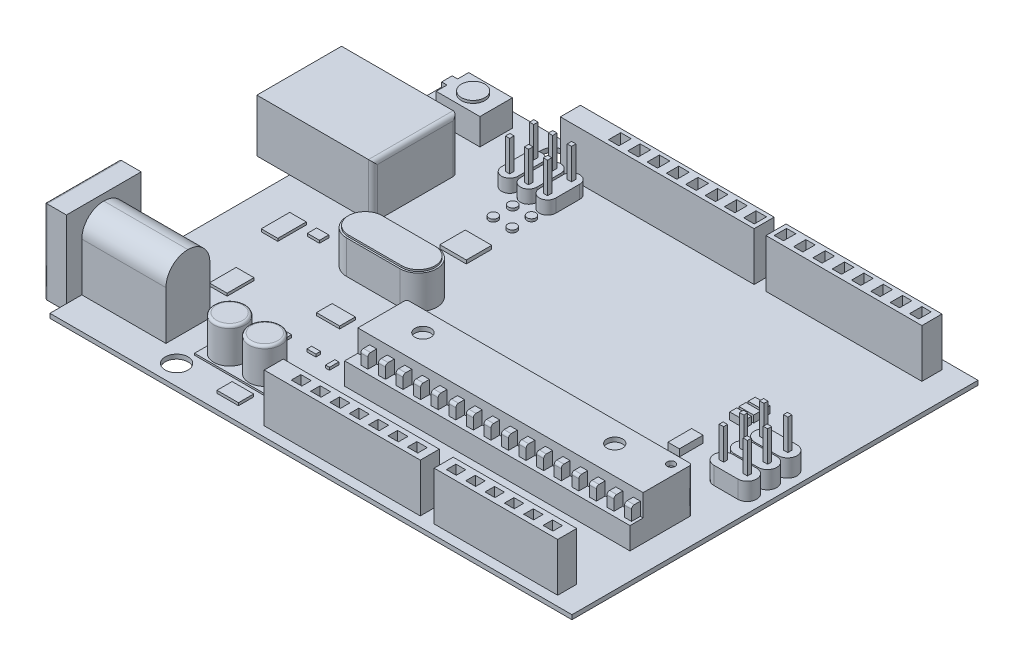
from build123d import *

# Parameters (mm, degrees)
BOSS_EXTRUDE2_DEPTH    = 55
SKETCH3_W              = 140.514955922
SKETCH3_H              = 21.639303212
BOSS_EXTRUDE3_DEPTH    = 55
CUT_EXTRUDE1_START     = 5
SKETCH4_W              = 11.850658933
SKETCH4_H              = 10.834888168
SKETCH4_W_2            = 11.204003532
CUT_EXTRUDE1_DEPTH     = 50
SKETCH5_W              = 220.455310393
SKETCH5_H              = 22.830323406
BOSS_EXTRUDE4_DEPTH    = 55
SKETCH6_W              = 177.429354246
SKETCH6_H              = 22.830323406
BOSS_EXTRUDE5_DEPTH    = 55
CUT_EXTRUDE2_START     = 5
SKETCH7_W              = 11.936344285
SKETCH7_H              = 14.002250028
SKETCH7_W_2            = 10.5429453
CUT_EXTRUDE2_DEPTH     = 50
SKETCH8_W              = 324.618660934
SKETCH8_H              = 70.631313038
BOSS_EXTRUDE6_DEPTH    = 25
SKETCH9_W              = 324.618660934
SKETCH9_H              = 55.631313038
BOSS_EXTRUDE7_DEPTH    = 25
FILLET1_R              = 3
FILLET2_R              = 3
SKETCH10_W             = 8
SKETCH10_H             = 15
BOSS_EXTRUDE8_DEPTH    = 10
FILLET3_R              = 3
LPATTERN1_COUNT        = 16
LPATTERN1_PITCH        = 20
FILLET3_OF_LPATTERN1_R = 3
SKETCH11_R             = 9
SKETCH11_R_2           = 4.513225895
CUT_EXTRUDE3_DEPTH     = 5
BOSS_EXTRUDE9_DEPTH    = 20
BOSS_EXTRUDE9_2_DEPTH  = 20
BOSS_EXTRUDE9_3_DEPTH  = 20
SKETCH13_W             = 5
SKETCH13_H             = 4.487343
BOSS_EXTRUDE10_DEPTH   = 35
SKETCH14_W             = 13.054082129
SKETCH14_H             = 26.924044392
BOSS_EXTRUDE11_DEPTH   = 8
SKETCH15_W             = 16.725542728
SKETCH15_H             = 8
BOSS_EXTRUDE12_DEPTH   = 8
BOSS_EXTRUDE12_2_DEPTH = 8
BOSS_EXTRUDE12_3_DEPTH = 8
BOSS_EXTRUDE13_DEPTH   = 15
BOSS_EXTRUDE13_2_DEPTH = 15
BOSS_EXTRUDE13_3_DEPTH = 15
SKETCH17_W             = 4.794005122
SKETCH17_H             = 5
BOSS_EXTRUDE14_DEPTH   = 35
SKETCH18_R             = 5
BOSS_EXTRUDE15_DEPTH   = 3
BOSS_EXTRUDE15_2_DEPTH = 3
SKETCH19_R             = 5
BOSS_EXTRUDE16_DEPTH   = 3
BOSS_EXTRUDE16_2_DEPTH = 3
SKETCH20_W             = 30.070200568
SKETCH20_H             = 28.94608092
BOSS_EXTRUDE17_DEPTH   = 4
BOSS_EXTRUDE18_DEPTH   = 38
BOSS_EXTRUDE19_DEPTH   = 2
SKETCH23_W             = 26.397561438
SKETCH23_H             = 17.836190161
BOSS_EXTRUDE20_DEPTH   = 3
SKETCH24_W             = 8.430897355
SKETCH24_H             = 10.67913665
BOSS_EXTRUDE21_DEPTH   = 3
SKETCH24_W_2           = 10.117076826
SKETCH24_H_2           = 5.339568325
BOSS_EXTRUDE21_2_DEPTH = 3
SKETCH24_W_3           = 4.49647859
BOSS_EXTRUDE21_3_DEPTH = 3
SKETCH25_W             = 80
SKETCH25_H             = 39.903369736
BOSS_EXTRUDE22_DEPTH   = 2
SKETCH26_R             = 18
BOSS_EXTRUDE23_DEPTH   = 40
FILLET4_R              = 3
SKETCH27_W             = 24.491756817
SKETCH27_H             = 17.260857185
BOSS_EXTRUDE24_DEPTH   = 3
SKETCH28_W             = 131.987807193
SKETCH28_H             = 96.315426871
BOSS_EXTRUDE25_DEPTH   = 60
CUT_EXTRUDE4_DEPTH     = 80
SKETCH30_W             = 40.013805294
SKETCH30_H             = 14.419389296
BOSS_EXTRUDE26_DEPTH   = 80
FILLET5_R              = 5
BOSS_EXTRUDE27_DEPTH   = 30
SKETCH32_R             = 13.354909124
BOSS_EXTRUDE28_DEPTH   = 3
SKETCH33_W             = 95.708096648
SKETCH33_H             = 50
BOSS_EXTRUDE29_DEPTH   = 80
SKETCH34_W             = 85
SKETCH34_H             = 95
BOSS_EXTRUDE30_DEPTH   = 25
FILLET6_R              = 25
SKETCH35_R             = 21.697959762
CUT_EXTRUDE5_DEPTH     = 97
FILLET7_R              = 3
SKETCH36_W             = 18.831629025
SKETCH36_H             = 32.390401922
BOSS_EXTRUDE31_DEPTH   = 3
SKETCH36_W_2           = 13.782631251
SKETCH36_H_2           = 10.600232663
BOSS_EXTRUDE31_2_DEPTH = 3
SKETCH37_W             = 20.243239651
SKETCH37_H             = 30.580213089
BOSS_EXTRUDE32_DEPTH   = 3
SKETCH39_W             = 594
SKETCH39_H             = 462
BOSS_EXTRUDE33_DEPTH   = 5
SKETCH38_R             = 13.537031913
SKETCH38_R_2           = 12.986709959
CUT_EXTRUDE6_DEPTH     = 758.585803721
SCALE1_SCALE           = 0.5


with BuildPart() as part:
    # Sketch2 → Boss-Extrude2 (new body)
    with BuildSketch(Plane(origin=(0, 100, 0), x_dir=(1, 0, 0), z_dir=(0, 1, 0))):
        Polygon((406.248513128, 32.646926651), (410.39103989, 32.646926651), (410.39103989, 11.007623439), (406.248513128, 11.007623439), (232.853057519, 11.007623439), (232.853057519, 32.646926651), align=None)
    extrude(amount=BOSS_EXTRUDE2_DEPTH)


with BuildPart() as body_2:
    # Sketch3 → Boss-Extrude3 (new body)
    with BuildSketch(Plane(origin=(0, 100, 0), x_dir=(1, 0, 0), z_dir=(0, 1, 0))):
        with Locations((496.46809161, 21.827275045)):
            Rectangle(SKETCH3_W, SKETCH3_H)
    extrude(amount=BOSS_EXTRUDE3_DEPTH)


with BuildPart() as cut_extrude1_tool:
    # Sketch4 → Cut-Extrude1 (new body)
    with BuildSketch(Plane(origin=(0, 100, 0), x_dir=(1, 0, 0), z_dir=(0, 1, 0)).offset(CUT_EXTRUDE1_START)):
        with Locations((264.057662434, 21.953706004)):
            Rectangle(SKETCH4_W, SKETCH4_H)
        with Locations((286.057662434, 21.953706004)):
            Rectangle(SKETCH4_W, SKETCH4_H)
        with Locations((308.057662434, 21.953706004)):
            Rectangle(SKETCH4_W, SKETCH4_H)
        with Locations((330.057662434, 21.953706004)):
            Rectangle(SKETCH4_W, SKETCH4_H)
        with Locations((352.057662434, 21.953706004)):
            Rectangle(SKETCH4_W, SKETCH4_H)
        with Locations((374.057662434, 21.953706004)):
            Rectangle(SKETCH4_W, SKETCH4_H)
        with Locations((396.057662434, 21.953706004)):
            Rectangle(SKETCH4_W, SKETCH4_H)
        with Locations((440.192463475, 21.953706004)):
            Rectangle(SKETCH4_W_2, SKETCH4_H)
        with Locations((462.192463475, 21.953706004)):
            Rectangle(SKETCH4_W_2, SKETCH4_H)
        with Locations((484.192463475, 21.953706004)):
            Rectangle(SKETCH4_W_2, SKETCH4_H)
        with Locations((506.192463475, 21.953706004)):
            Rectangle(SKETCH4_W_2, SKETCH4_H)
        with Locations((528.192463475, 21.953706004)):
            Rectangle(SKETCH4_W_2, SKETCH4_H)
        with Locations((550.192463475, 21.953706004)):
            Rectangle(SKETCH4_W_2, SKETCH4_H)
    extrude(amount=CUT_EXTRUDE1_DEPTH)


with BuildPart() as part_1:
    add(part.part)

    # Cut-Extrude1: cut by cut_extrude1_tool
    add(cut_extrude1_tool.part, mode=Mode.SUBTRACT)



with BuildPart() as body_2_1:
    add(body_2.part)

    # Cut-Extrude1: cut by cut_extrude1_tool
    add(cut_extrude1_tool.part, mode=Mode.SUBTRACT)


with BuildPart() as body_3:
    # Sketch5 → Boss-Extrude4 (new body)
    with BuildSketch(Plane(origin=(0, 100, 0), x_dir=(1, 0, 0), z_dir=(0, 1, 0))):
        with Locations((262.041067284, 440.396872493)):
            Rectangle(SKETCH5_W, SKETCH5_H)
    extrude(amount=BOSS_EXTRUDE4_DEPTH)


with BuildPart() as body_4:
    # Sketch6 → Boss-Extrude5 (new body)
    with BuildSketch(Plane(origin=(0, 100, 0), x_dir=(1, 0, 0), z_dir=(0, 1, 0))):
        with Locations((474.456716745, 440.396872493)):
            Rectangle(SKETCH6_W, SKETCH6_H)
    extrude(amount=BOSS_EXTRUDE5_DEPTH)


with BuildPart() as cut_extrude2_tool:
    # Sketch7 → Cut-Extrude2 (new body)
    with BuildSketch(Plane(origin=(0, 100, 0), x_dir=(1, 0, 0), z_dir=(0, 1, 0)).offset(CUT_EXTRUDE2_START)):
        with Locations((207.691240249, 440.745978972)):
            Rectangle(SKETCH7_W, SKETCH7_H)
        with Locations((229.691240249, 440.745978972)):
            Rectangle(SKETCH7_W, SKETCH7_H)
        with Locations((251.691240249, 440.745978972)):
            Rectangle(SKETCH7_W, SKETCH7_H)
        with Locations((273.691240248, 440.745978972)):
            Rectangle(SKETCH7_W, SKETCH7_H)
        with Locations((295.691240249, 440.745978972)):
            Rectangle(SKETCH7_W, SKETCH7_H)
        with Locations((317.691240249, 440.745978972)):
            Rectangle(SKETCH7_W, SKETCH7_H)
        with Locations((339.691240249, 440.745978972)):
            Rectangle(SKETCH7_W, SKETCH7_H)
        with Locations((361.691240249, 440.745978972)):
            Rectangle(SKETCH7_W, SKETCH7_H)
        with Locations((395.678951184, 440.745978972)):
            Rectangle(SKETCH7_W_2, SKETCH7_H)
        with Locations((417.678951184, 440.745978972)):
            Rectangle(SKETCH7_W_2, SKETCH7_H)
        with Locations((439.678951184, 440.745978972)):
            Rectangle(SKETCH7_W_2, SKETCH7_H)
        with Locations((461.678951184, 440.745978972)):
            Rectangle(SKETCH7_W_2, SKETCH7_H)
        with Locations((483.678951184, 440.745978972)):
            Rectangle(SKETCH7_W_2, SKETCH7_H)
        with Locations((505.678951184, 440.745978972)):
            Rectangle(SKETCH7_W_2, SKETCH7_H)
        with Locations((527.678951184, 440.745978972)):
            Rectangle(SKETCH7_W_2, SKETCH7_H)
        with Locations((549.678951184, 440.745978972)):
            Rectangle(SKETCH7_W_2, SKETCH7_H)
    extrude(amount=CUT_EXTRUDE2_DEPTH)


with BuildPart() as body_3_1:
    add(body_3.part)

    # Cut-Extrude2: cut by cut_extrude2_tool
    add(cut_extrude2_tool.part, mode=Mode.SUBTRACT)


with BuildPart() as body_4_1:
    add(body_4.part)

    # Cut-Extrude2: cut by cut_extrude2_tool
    add(cut_extrude2_tool.part, mode=Mode.SUBTRACT)


with BuildPart() as body_5:
    # Sketch8 → Boss-Extrude6 (new body)
    with BuildSketch(Plane(origin=(0, 100, 0), x_dir=(1, 0, 0), z_dir=(0, 1, 0))):
        with Locations((401.876798148, 131.117335097)):
            Rectangle(SKETCH8_W, SKETCH8_H)
    extrude(amount=BOSS_EXTRUDE6_DEPTH)

    # Sketch9 → Boss-Extrude7 (add)
    with BuildSketch(Plane(origin=(0, 125, 0), x_dir=(1, 0, 0), z_dir=(0, 1, 0))):
        with Locations((401.876798148, 138.617335097)):
            Rectangle(SKETCH9_W, SKETCH9_H)
    extrude(amount=BOSS_EXTRUDE7_DEPTH)

    # Fillet1
    fillet1_edges = [body_5.edges().sort_by_distance(p)[0] for p in [
        (239.567467681, 125, -166.432991616),
    ]]
    fillet(fillet1_edges, radius=FILLET1_R)

    # Fillet2
    fillet2_edges = [body_5.edges().sort_by_distance(p)[0] for p in [
        (564.186128615, 125, -166.432991616),
    ]]
    fillet(fillet2_edges, radius=FILLET2_R)

    # Sketch10 → Boss-Extrude8 (add)
    with BuildSketch(Plane.XY.offset(-110.801678578)):
        with Locations((257.009389887, 132.5)):
            Rectangle(SKETCH10_W, SKETCH10_H)
    boss_extrude8 = extrude(amount=BOSS_EXTRUDE8_DEPTH)

    # Fillet3
    fillet3_edges = [body_5.edges().sort_by_distance(p)[0] for p in [
        (257.009389887, 140, -100.801678578),
    ]]
    fillet(fillet3_edges, radius=FILLET3_R)

    # LPattern1: Boss-Extrude8 ×16
    with Locations(*[(i * LPATTERN1_PITCH, 0, 0) for i in range(1, LPATTERN1_COUNT)]):
        add(boss_extrude8)

    # Fillet3 of LPattern1
    fillet3_of_lpattern1_edges = [body_5.edges().sort_by_distance(p)[0] for p in [
        (277.009389887, 140, -100.801678578),
        (297.009389887, 140, -100.801678578),
        (317.009389887, 140, -100.801678578),
        (337.009389887, 140, -100.801678578),
        (357.009389887, 140, -100.801678578),
        (377.009389887, 140, -100.801678578),
        (397.009389887, 140, -100.801678578),
        (417.009389887, 140, -100.801678578),
        (437.009389887, 140, -100.801678578),
        (457.009389887, 140, -100.801678578),
        (477.009389887, 140, -100.801678578),
        (497.009389887, 140, -100.801678578),
        (517.009389887, 140, -100.801678578),
        (537.009389887, 140, -100.801678578),
        (557.009389887, 140, -100.801678578),
    ]]
    fillet(fillet3_of_lpattern1_edges, radius=FILLET3_OF_LPATTERN1_R)

    # Sketch11 → Cut-Extrude3 (cut)
    with BuildSketch(Plane(origin=(0, 150, 0), x_dir=(1, 0, 0), z_dir=(0, 1, 0))):
        with Locations(Location((281.372940119, 143.017085272, 0), (0, 0, 270))):
            Circle(SKETCH11_R)
        with Locations(Location((499.66166973, 143.017085272, 0), (0, 0, 270))):
            Circle(SKETCH11_R)
        with Locations(Location((552.041174275, 154.806553195, 0), (0, 0, 270))):
            Circle(SKETCH11_R_2)
    extrude(amount=-CUT_EXTRUDE3_DEPTH, mode=Mode.SUBTRACT)


with BuildPart() as body_6:
    # Sketch12 → Boss-Extrude9 (new body)
    with BuildSketch(Plane(origin=(0, 100, 0), x_dir=(1, 0, 0), z_dir=(0, 1, 0))):
        with BuildLine():
            Line((547.517549409, 275.451253059), (574.628558454, 275.451253059))
            ThreePointArc((574.628558454, 275.451253059), (585.330272551, 264.749538962), (574.628558454, 254.047824865))
            Line((574.628558454, 254.047824865), (547.517549409, 254.047824865))
            ThreePointArc((547.517549409, 254.047824865), (536.815835312, 264.749538962), (547.517549409, 275.451253059))
        make_face()
    extrude(amount=BOSS_EXTRUDE9_DEPTH)



with BuildPart() as body_7:
    # Sketch12 → Boss-Extrude9 2 (new body)
    with BuildSketch(Plane(origin=(0, 100, 0), x_dir=(1, 0, 0), z_dir=(0, 1, 0))):
        with BuildLine():
            Line((547.517549409, 252.451253059), (574.628558454, 252.451253059))
            ThreePointArc((574.628558454, 252.451253059), (585.330272551, 241.749538962), (574.628558454, 231.047824865))
            Line((574.628558454, 231.047824865), (547.517549409, 231.047824865))
            ThreePointArc((547.517549409, 231.047824865), (536.815835312, 241.749538962), (547.517549409, 252.451253059))
        make_face()
    extrude(amount=BOSS_EXTRUDE9_2_DEPTH)


with BuildPart() as body_8:
    # Sketch12 → Boss-Extrude9 3 (new body)
    with BuildSketch(Plane(origin=(0, 100, 0), x_dir=(1, 0, 0), z_dir=(0, 1, 0))):
        with BuildLine():
            Line((547.517549409, 229.451253059), (574.628558454, 229.451253059))
            ThreePointArc((574.628558454, 229.451253059), (585.330272551, 218.749538962), (574.628558454, 208.047824865))
            Line((574.628558454, 208.047824865), (547.517549409, 208.047824865))
            ThreePointArc((547.517549409, 208.047824865), (536.815835312, 218.749538962), (547.517549409, 229.451253059))
        make_face()
    extrude(amount=BOSS_EXTRUDE9_3_DEPTH)


with BuildPart() as body_6_1:
    add(body_6.part)

    add(body_7.part)  # Boss-Extrude10 merges body 7

    add(body_8.part)  # Boss-Extrude10 merges body 8
    # Sketch13 → Boss-Extrude10 (add)
    with BuildSketch(Plane(origin=(0, 120, 0), x_dir=(1, 0, 0), z_dir=(0, 1, 0))):
        with Locations((547.517549409, 241.749538962)):
            Rectangle(SKETCH13_W, SKETCH13_H)
        with Locations((547.517549409, 264.749538962)):
            Rectangle(SKETCH13_W, SKETCH13_H)
        with Locations((574.628558454, 264.749538962)):
            Rectangle(SKETCH13_W, SKETCH13_H)
        with Locations((574.628558454, 241.749538962)):
            Rectangle(SKETCH13_W, SKETCH13_H)
        with Locations((547.517549409, 218.749538962)):
            Rectangle(SKETCH13_W, SKETCH13_H)
        with Locations((574.628558454, 218.749538962)):
            Rectangle(SKETCH13_W, SKETCH13_H)
    extrude(amount=BOSS_EXTRUDE10_DEPTH)


with BuildPart() as body_7_2:
    # Sketch14 → Boss-Extrude11 (new body)
    with BuildSketch(Plane(origin=(0, 100, 0), x_dir=(1, 0, 0), z_dir=(0, 1, 0))):
        with Locations((493.129270674, 230.042416205)):
            Rectangle(SKETCH14_W, SKETCH14_H)
    extrude(amount=BOSS_EXTRUDE11_DEPTH)


with BuildPart() as body_8_2:
    # Sketch15 → Boss-Extrude12 (new body)
    with BuildSketch(Plane(origin=(0, 100, 0), x_dir=(1, 0, 0), z_dir=(0, 1, 0))):
        with Locations((500.268221838, 306.602608522)):
            Rectangle(SKETCH15_W, SKETCH15_H)
    extrude(amount=BOSS_EXTRUDE12_DEPTH)


with BuildPart() as body_9:
    # Sketch15 → Boss-Extrude12 2 (new body)
    with BuildSketch(Plane(origin=(0, 100, 0), x_dir=(1, 0, 0), z_dir=(0, 1, 0))):
        with Locations((500.268221838, 296.102608522)):
            Rectangle(SKETCH15_W, SKETCH15_H)
    extrude(amount=BOSS_EXTRUDE12_2_DEPTH)


with BuildPart() as body_10:
    # Sketch15 → Boss-Extrude12 3 (new body)
    with BuildSketch(Plane(origin=(0, 100, 0), x_dir=(1, 0, 0), z_dir=(0, 1, 0))):
        with Locations((500.268221838, 285.602608522)):
            Rectangle(SKETCH15_W, SKETCH15_H)
    extrude(amount=BOSS_EXTRUDE12_3_DEPTH)


with BuildPart() as body_11:
    # Sketch16 → Boss-Extrude13 (new body)
    with BuildSketch(Plane(origin=(0, 100, 0), x_dir=(1, 0, 0), z_dir=(0, 1, 0))):
        with BuildLine():
            Line((146.171960946, 413.685173852), (146.171960946, 386.394359112))
            ThreePointArc((146.171960946, 386.394359112), (136.841767873, 377.064166039), (127.511574799, 386.394359112))
            Line((127.511574799, 386.394359112), (127.511574799, 413.685173852))
            ThreePointArc((127.511574799, 413.685173852), (136.841767873, 423.015366925), (146.171960946, 413.685173852))
        make_face()
    extrude(amount=BOSS_EXTRUDE13_DEPTH)



with BuildPart() as body_12:
    # Sketch16 → Boss-Extrude13 2 (new body)
    with BuildSketch(Plane(origin=(0, 100, 0), x_dir=(1, 0, 0), z_dir=(0, 1, 0))):
        with BuildLine():
            Line((167.671960946, 413.685173852), (167.671960946, 386.394359112))
            ThreePointArc((167.671960946, 386.394359112), (158.341767873, 377.064166039), (149.011574799, 386.394359112))
            Line((149.011574799, 386.394359112), (149.011574799, 413.685173852))
            ThreePointArc((149.011574799, 413.685173852), (158.341767873, 423.015366925), (167.671960946, 413.685173852))
        make_face()
    extrude(amount=BOSS_EXTRUDE13_2_DEPTH)


with BuildPart() as body_13:
    # Sketch16 → Boss-Extrude13 3 (new body)
    with BuildSketch(Plane(origin=(0, 100, 0), x_dir=(1, 0, 0), z_dir=(0, 1, 0))):
        with BuildLine():
            Line((189.171960946, 413.685173852), (189.171960946, 386.394359112))
            ThreePointArc((189.171960946, 386.394359112), (179.841767873, 377.064166039), (170.511574799, 386.394359112))
            Line((170.511574799, 386.394359112), (170.511574799, 413.685173852))
            ThreePointArc((170.511574799, 413.685173852), (179.841767873, 423.015366925), (189.171960946, 413.685173852))
        make_face()
    extrude(amount=BOSS_EXTRUDE13_3_DEPTH)


with BuildPart() as body_11_1:
    add(body_11.part)

    add(body_12.part)  # Boss-Extrude14 merges body 12

    add(body_13.part)  # Boss-Extrude14 merges body 13
    # Sketch17 → Boss-Extrude14 (add)
    with BuildSketch(Plane(origin=(0, 115, 0), x_dir=(1, 0, 0), z_dir=(0, 1, 0))):
        with Locations((158.341767873, 386.394359112)):
            Rectangle(SKETCH17_W, SKETCH17_H)
        with Locations((136.841767873, 413.685173852)):
            Rectangle(SKETCH17_W, SKETCH17_H)
        with Locations((136.841767873, 386.394359112)):
            Rectangle(SKETCH17_W, SKETCH17_H)
        with Locations((158.341767873, 413.685173852)):
            Rectangle(SKETCH17_W, SKETCH17_H)
        with Locations((179.841767873, 386.394359112)):
            Rectangle(SKETCH17_W, SKETCH17_H)
        with Locations((179.841767873, 413.685173852)):
            Rectangle(SKETCH17_W, SKETCH17_H)
    extrude(amount=BOSS_EXTRUDE14_DEPTH)


with BuildPart() as body_12_2:
    # Sketch18 → Boss-Extrude15 (new body)
    with BuildSketch(Plane(origin=(0, 100, 0), x_dir=(1, 0, 0), z_dir=(0, 1, 0))):
        with Locations(Location((159.014308683, 367.570995224, 0), (0, 0, 270))):
            Circle(SKETCH18_R)
    extrude(amount=BOSS_EXTRUDE15_DEPTH)


with BuildPart() as body_13_2:
    # Sketch18 → Boss-Extrude15 2 (new body)
    with BuildSketch(Plane(origin=(0, 100, 0), x_dir=(1, 0, 0), z_dir=(0, 1, 0))):
        with Locations(Location((180.310474373, 367.570995224, 0), (0, 0, 270))):
            Circle(SKETCH18_R)
    extrude(amount=BOSS_EXTRUDE15_2_DEPTH)


with BuildPart() as body_14:
    # Sketch19 → Boss-Extrude16 (new body)
    with BuildSketch(Plane(origin=(0, 100, 0), x_dir=(1, 0, 0), z_dir=(0, 1, 0))):
        with Locations(Location((158.910816745, 345.61565714, 0), (0, 0, 270))):
            Circle(SKETCH19_R)
    extrude(amount=BOSS_EXTRUDE16_DEPTH)


with BuildPart() as body_15:
    # Sketch19 → Boss-Extrude16 2 (new body)
    with BuildSketch(Plane(origin=(0, 100, 0), x_dir=(1, 0, 0), z_dir=(0, 1, 0))):
        with Locations(Location((180.400583941, 345.61565714, 0), (0, 0, 270))):
            Circle(SKETCH19_R)
    extrude(amount=BOSS_EXTRUDE16_2_DEPTH)


with BuildPart() as body_16:
    # Sketch20 → Boss-Extrude17 (new body)
    with BuildSketch(Plane(origin=(0, 100, 0), x_dir=(1, 0, 0), z_dir=(0, 1, 0))):
        with Locations((173.285663949, 299.908366785)):
            Rectangle(SKETCH20_W, SKETCH20_H)
    extrude(amount=BOSS_EXTRUDE17_DEPTH)


with BuildPart() as body_17:
    # Sketch21 → Boss-Extrude18 (new body)
    with BuildSketch(Plane(origin=(0, 100, 0), x_dir=(1, 0, 0), z_dir=(0, 1, 0))):
        with BuildLine():
            Line((132.676841687, 247.215258314), (193.098272734, 247.215258314))
            ThreePointArc((193.098272734, 247.215258314), (214.175516123, 226.138014926), (193.098272734, 205.060771537))
            Line((193.098272734, 205.060771537), (132.676841687, 205.060771537))
            ThreePointArc((132.676841687, 205.060771537), (111.599598299, 226.138014926), (132.676841687, 247.215258314))
        make_face()
    extrude(amount=BOSS_EXTRUDE18_DEPTH)

    # Sketch22 → Boss-Extrude19 (add)
    with BuildSketch(Plane(origin=(0, 138, 0), x_dir=(1, 0, 0), z_dir=(0, 1, 0))):
        with BuildLine():
            Line((132.676841687, 207.060771537), (193.098272734, 207.060771537))
            ThreePointArc((193.098272734, 207.060771537), (212.175516123, 226.138014926), (193.098272734, 245.215258314))
            Line((193.098272734, 245.215258314), (132.676841687, 245.215258314))
            ThreePointArc((132.676841687, 245.215258314), (113.599598299, 226.138014926), (132.676841687, 207.060771537))
        make_face()
    extrude(amount=BOSS_EXTRUDE19_DEPTH)


with BuildPart() as body_18:
    # Sketch23 → Boss-Extrude20 (new body)
    with BuildSketch(Plane(origin=(0, 100, 0), x_dir=(1, 0, 0), z_dir=(0, 1, 0))):
        with Locations((167.152535626, 158.228344143)):
            Rectangle(SKETCH23_W, SKETCH23_H)
    extrude(amount=BOSS_EXTRUDE20_DEPTH)


with BuildPart() as body_19:
    # Sketch24 → Boss-Extrude21 (new body)
    with BuildSketch(Plane(origin=(0, 100, 0), x_dir=(1, 0, 0), z_dir=(0, 1, 0))):
        with Locations((157.358825507, 108.14372549)):
            Rectangle(SKETCH24_W, SKETCH24_H)
    extrude(amount=BOSS_EXTRUDE21_DEPTH)


with BuildPart() as body_20:
    # Sketch24 → Boss-Extrude21 2 (new body)
    with BuildSketch(Plane(origin=(0, 100, 0), x_dir=(1, 0, 0), z_dir=(0, 1, 0))):
        with Locations((189.396235457, 110.813509653)):
            Rectangle(SKETCH24_W_2, SKETCH24_H_2)
    extrude(amount=BOSS_EXTRUDE21_2_DEPTH)


with BuildPart() as body_21:
    # Sketch24 → Boss-Extrude21 3 (new body)
    with BuildSketch(Plane(origin=(0, 100, 0), x_dir=(1, 0, 0), z_dir=(0, 1, 0))):
        with Locations((213.002748052, 108.14372549)):
            Rectangle(SKETCH24_W_3, SKETCH24_H)
    extrude(amount=BOSS_EXTRUDE21_3_DEPTH)


with BuildPart() as body_22:
    # Sketch25 → Boss-Extrude22 (new body)
    with BuildSketch(Plane(origin=(0, 100, 0), x_dir=(1, 0, 0), z_dir=(0, 1, 0))):
        with Locations((163.627815401, 60.874256451)):
            Rectangle(SKETCH25_W, SKETCH25_H)
    extrude(amount=BOSS_EXTRUDE22_DEPTH)

    # Sketch26 → Boss-Extrude23 (add)
    with BuildSketch(Plane(origin=(0, 102, 0), x_dir=(1, 0, 0), z_dir=(0, 1, 0))):
        with Locations(Location((143.627815401, 60.874256451, 0), (0, 0, 270))):
            Circle(SKETCH26_R)
        with Locations(Location((183.627815401, 60.874256451, 0), (0, 0, 270))):
            Circle(SKETCH26_R)
    extrude(amount=BOSS_EXTRUDE23_DEPTH)

    # Fillet4
    fillet4_edges = [body_22.edges().sort_by_distance(p)[0] for p in [
        (143.627815401, 142, -78.874256451),
        (183.627815401, 142, -78.874256451),
    ]]
    fillet(fillet4_edges, radius=FILLET4_R)


with BuildPart() as body_23:
    # Sketch27 → Boss-Extrude24 (new body)
    with BuildSketch(Plane(origin=(0, 100, 0), x_dir=(1, 0, 0), z_dir=(0, 1, 0))):
        with Locations((186.138192793, 24.786610899)):
            Rectangle(SKETCH27_W, SKETCH27_H)
    extrude(amount=BOSS_EXTRUDE24_DEPTH)


with BuildPart() as body_24:
    # Sketch28 → Boss-Extrude25 (new body)
    with BuildSketch(Plane(origin=(0, 100, 0), x_dir=(1, 0, 0), z_dir=(0, 1, 0))):
        with Locations((28.743699975, 320.894398413)):
            Rectangle(SKETCH28_W, SKETCH28_H)
    extrude(amount=BOSS_EXTRUDE25_DEPTH)

    # Sketch29 → Cut-Extrude4 (cut)
    with BuildSketch(Plane.ZY.offset(37.250203622)):
        Polygon((-359.052111848, 143.624210904), (-341.052111848, 150.165159017), (-300.736684977, 150.165159017), (-282.736684977, 143.624210904), (-282.736684977, 110), (-359.052111848, 110), align=None)
    extrude(amount=-CUT_EXTRUDE4_DEPTH, mode=Mode.SUBTRACT)

    # Sketch30 → Boss-Extrude26 (add)
    with BuildSketch(Plane.ZY.offset(-42.749796378)):
        with Locations((-322.95109062, 129.095180551)):
            Rectangle(SKETCH30_W, SKETCH30_H)
    extrude(amount=BOSS_EXTRUDE26_DEPTH)

    # Fillet5
    fillet5_edges = [body_24.edges().sort_by_distance(p)[0] for p in [
        (94.737603571, 160, -320.894398413),
        (-37.250203622, 126.812105452, -359.052111848),
        (-37.250203622, 126.812105452, -282.736684977),
        (94.737603571, 130, -369.052111848),
        (94.737603571, 130, -272.736684977),
    ]]
    fillet(fillet5_edges, radius=FILLET5_R)


with BuildPart() as body_25:
    # Sketch31 → Boss-Extrude27 (new body)
    with BuildSketch(Plane(origin=(0, 100, 0), x_dir=(1, 0, 0), z_dir=(0, 1, 0))):
        Polygon((31.007410333, 445.458661852), (80.754514515, 445.458661852), (80.754514515, 408.517742905), (31.007410333, 408.517742905), (31.007410333, 420.831382554), (24.850590509, 420.831382554), (24.850590509, 432.89874941), (31.007410333, 432.89874941), align=None)
    extrude(amount=BOSS_EXTRUDE27_DEPTH)

    # Sketch32 → Boss-Extrude28 (add)
    with BuildSketch(Plane(origin=(0, 130, 0), x_dir=(1, 0, 0), z_dir=(0, 1, 0))):
        with Locations(Location((54.578507847, 426.988202379, 0), (0, 0, 270))):
            Circle(SKETCH32_R)
    extrude(amount=BOSS_EXTRUDE28_DEPTH)


with BuildPart() as body_26:
    # Sketch33 → Boss-Extrude29 (new body)
    with BuildSketch(Plane(origin=(0, 100, 0), x_dir=(1, 0, 0), z_dir=(0, 1, 0))):
        with Locations((47.854048324, 61.280955883)):
            Rectangle(SKETCH33_W, SKETCH33_H)
    extrude(amount=BOSS_EXTRUDE29_DEPTH)

    # Sketch34 → Boss-Extrude30 (add)
    with BuildSketch(Plane.ZY):
        with Locations((-61.280955883, 140)):
            Rectangle(SKETCH34_W, SKETCH34_H)
    extrude(amount=BOSS_EXTRUDE30_DEPTH)

    # Fillet6
    fillet6_edges = [body_26.edges().sort_by_distance(p)[0] for p in [
        (47.854048324, 180, -86.280955883),
        (47.854048324, 180, -36.280955883),
    ]]
    fillet(fillet6_edges, radius=FILLET6_R - 0.0001)  # a hair under: the kernel refuses the full size

    # Sketch35 → Cut-Extrude5 (cut)
    with BuildSketch(Plane.ZY.offset(25)):
        with Locations((-61.280955883, 139.184137816)):
            Circle(SKETCH35_R)
    extrude(amount=-CUT_EXTRUDE5_DEPTH, mode=Mode.SUBTRACT)

    # Fillet7
    fillet7_edges = [body_26.edges().sort_by_distance(p)[0] for p in [
        (-25, 140, -18.780955883),
        (-25, 187.5, -61.280955883),
        (-25, 140, -103.780955883),
        (-25, 92.5, -61.280955883),
    ]]
    fillet(fillet7_edges, radius=FILLET7_R)


with BuildPart() as body_27:
    # Sketch36 → Boss-Extrude31 (new body)
    with BuildSketch(Plane(origin=(0, 100, 0), x_dir=(1, 0, 0), z_dir=(0, 1, 0))):
        with Locations((49.382289247, 216.687961941)):
            Rectangle(SKETCH36_W, SKETCH36_H)
    extrude(amount=BOSS_EXTRUDE31_DEPTH)


with BuildPart() as body_28:
    # Sketch36 → Boss-Extrude31 2 (new body)
    with BuildSketch(Plane(origin=(0, 100, 0), x_dir=(1, 0, 0), z_dir=(0, 1, 0))):
        with Locations((77.524764738, 227.583046571)):
            Rectangle(SKETCH36_W_2, SKETCH36_H_2)
    extrude(amount=BOSS_EXTRUDE31_2_DEPTH)


with BuildPart() as body_29:
    # Sketch37 → Boss-Extrude32 (new body)
    with BuildSketch(Plane(origin=(0, 100, 0), x_dir=(1, 0, 0), z_dir=(0, 1, 0))):
        with Locations((73.863753312, 132.911180718)):
            Rectangle(SKETCH37_W, SKETCH37_H)
    extrude(amount=BOSS_EXTRUDE32_DEPTH)


with BuildPart() as part_2:
    add(part_1.part)

    add(body_2_1.part)  # Boss-Extrude33 merges body 2

    add(body_3_1.part)  # Boss-Extrude33 merges body 3

    add(body_4_1.part)  # Boss-Extrude33 merges body 4

    add(body_5.part)  # Boss-Extrude33 merges body 5

    add(body_6_1.part)  # Boss-Extrude33 merges body 6

    add(body_7_2.part)  # Boss-Extrude33 merges body 7 2

    add(body_8_2.part)  # Boss-Extrude33 merges body 8 2

    add(body_9.part)  # Boss-Extrude33 merges body 9

    add(body_10.part)  # Boss-Extrude33 merges body 10

    add(body_11_1.part)  # Boss-Extrude33 merges body 11

    add(body_12_2.part)  # Boss-Extrude33 merges body 12 2

    add(body_13_2.part)  # Boss-Extrude33 merges body 13 2

    add(body_14.part)  # Boss-Extrude33 merges body 14

    add(body_15.part)  # Boss-Extrude33 merges body 15

    add(body_16.part)  # Boss-Extrude33 merges body 16

    add(body_17.part)  # Boss-Extrude33 merges body 17

    add(body_18.part)  # Boss-Extrude33 merges body 18

    add(body_19.part)  # Boss-Extrude33 merges body 19

    add(body_20.part)  # Boss-Extrude33 merges body 20

    add(body_21.part)  # Boss-Extrude33 merges body 21

    add(body_22.part)  # Boss-Extrude33 merges body 22

    add(body_23.part)  # Boss-Extrude33 merges body 23

    add(body_24.part)  # Boss-Extrude33 merges body 24

    add(body_25.part)  # Boss-Extrude33 merges body 25

    add(body_26.part)  # Boss-Extrude33 merges body 26

    add(body_27.part)  # Boss-Extrude33 merges body 27

    add(body_28.part)  # Boss-Extrude33 merges body 28

    add(body_29.part)  # Boss-Extrude33 merges body 29
    # Sketch39 → Boss-Extrude33 (add)
    with BuildSketch(Plane(origin=(0, 100, 0), x_dir=(1, 0, 0), z_dir=(0, 1, 0))):
        with Locations((297, 231)):
            Rectangle(SKETCH39_W, SKETCH39_H)
    extrude(amount=-BOSS_EXTRUDE33_DEPTH)

    # Sketch38 → Cut-Extrude6 (cut, through all)
    with BuildSketch(Plane(origin=(0, 100, 0), x_dir=(1, 0, 0), z_dir=(0, 1, 0))):
        with Locations(Location((132.411458342, 439.875591208, 0), (0, 0, 270))):
            Circle(SKETCH38_R)
        with Locations(Location((121.477098931, 22.66906892, 0), (0, 0, 270))):
            Circle(SKETCH38_R_2)
    extrude(amount=-CUT_EXTRUDE6_DEPTH, mode=Mode.SUBTRACT)


with BuildPart() as part_3:
    # Scale1: scaled about (266.406458863, 117.646003668, -208.558289991)
    add(part_2.part.scale(SCALE1_SCALE).moved(Location((133.203229432, 58.823001834, -104.279144996))))


solid = part_3.part
